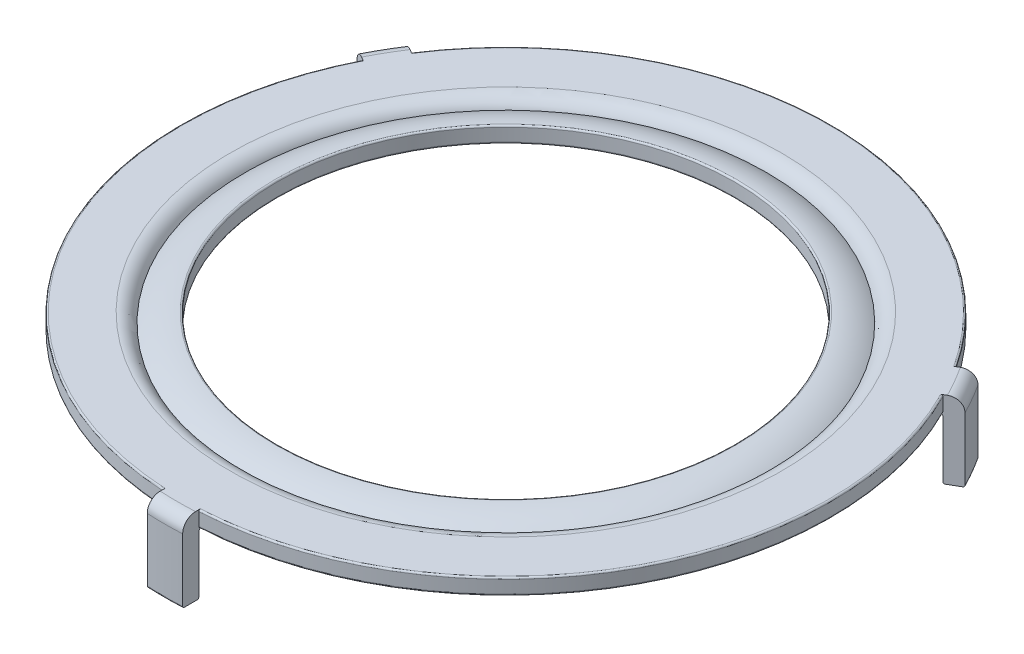
from build123d import *

# Parameters (mm, degrees)
RESSALTO_EXTRUS_O1_DEPTH = 12
FILETE1_R                = 2
FILETE2_R                = 0.25
FILETE3_R                = 0.5
FILETE4_R                = 0.25


with BuildPart() as part:
    # Esboço1 → Revolução2 (revolve)
    with BuildSketch(Plane.XY, mode=Mode.PRIVATE) as revolu_o2_sk:
        with BuildLine():
            Line((50.5, 2.1156409253243282), (50.5, 4.615640925324328))
            Line((50.5, 4.615640925324328), (42.79128784747792, 4.615640925324325))
            ThreePointArc((42.79128784747792, 4.615640925324325), (41.421981453715006, 4.207290991659514), (40.5, 3.1156409253243265))
            ThreePointArc((40.5, 3.1156409253243265), (38.109307633859444, 4.229999704855797), (35.5, 4.6156409253243265))
            Line((35.5, 4.6156409253243265), (35.5, 2.115640925324327))
            Line((35.5, 2.115640925324327), (38.5, 2.115640925324326))
            ThreePointArc((38.5, 2.115640925324326), (41.375, 0.8967153579852054), (44.25, 2.115640925324326))
            Line((44.25, 2.115640925324326), (50.5, 2.1156409253243282))
        make_face()
    revolve(revolu_o2_sk.sketch.rotate(Axis((0, -40.04789590254706, 0), (0, 1, 0)), 90), axis=Axis((0, -40.04789590254706, 0), (0, 1, 0)))

    # Esboço2 → Ressalto-extrusão1 (add)
    with BuildSketch(Plane(origin=(0, 4.6156409253243265, 0), x_dir=(1, 0, 0), z_dir=(0, 1, 0))):
        with BuildLine():
            Line((-47.21251874829168, 24.082733927903796), (-45.04439002321137, 22.83096422484113))
            ThreePointArc((-45.04439002321138, 22.830964224841132), (-43.734282891106815, 25.24999999999606), (-42.29439002321152, 27.594103945655235))
            Line((-42.29439002321151, 27.594103945655238), (-44.46251874829165, 28.845873648718204))
            ThreePointArc((-44.46251874829164, 28.8458736487182), (-45.899346400575126, 26.50000000000022), (-47.21251874829167, 24.082733927903792))
        make_face()
        with BuildLine():
            ThreePointArc((42.29439002321179, 27.594103945654822), (43.73428289110706, 25.249999999995644), (45.04439002321159, 22.830964224840706))
            Line((45.04439002321159, 22.83096422484071), (47.212518748292, 24.08273392790313))
            ThreePointArc((47.212518748292, 24.082733927903135), (45.899346400575496, 26.49999999999958), (44.46251874829204, 28.84587364871758))
            Line((44.46251874829204, 28.845873648717575), (42.29439002321178, 27.59410394565482))
        make_face()
        with BuildLine():
            Line((-2.750000000000071, -50.4250681704959), (-2.7500000000000027, -52.92860757662155))
            ThreePointArc((-2.7500000000000027, -52.92860757662155), (0, -53), (2.7500000000000036, -52.928607576621545))
            Line((2.7500000000000027, -52.92860757662155), (2.7499999999995683, -50.425068170495926))
            ThreePointArc((2.7499999999995683, -50.42506817049593), (-2.5191e-13, -50.499999999991665), (-2.7500000000000715, -50.425068170495905))
        make_face()
    extrude(amount=-RESSALTO_EXTRUS_O1_DEPTH)

    # Filete1
    filete1_edges = [part.edges().sort_by_distance(p)[0] for p in [
        (-45.899346400575126, 4.6156409253243265, -26.50000000000022),
        (45.899346400575496, 4.6156409253243265, -26.49999999999958),
        (2e-15, 4.6156409253243265, 53),
    ]]
    fillet(filete1_edges, radius=FILETE1_R)

    # Filete2
    filete2_edges = [part.edges().sort_by_distance(p)[0] for p in [
        (-45.899346400575126, -7.3843590746756735, -26.50000000000022),
        (-43.734282891106815, -7.3843590746756735, -25.249999999996064),
        (45.899346400575496, -7.3843590746756735, -26.49999999999958),
        (43.73428289110706, -7.3843590746756735, -25.249999999995637),
        (2e-15, -7.3843590746756735, 53),
        (-2.5147e-13, -7.3843590746756735, 50.49999999999167),
    ]]
    fillet(filete2_edges, radius=FILETE2_R)

    # Filete3
    # the kernel refuses this fillet: 0.5 mm, written as the material it adds along each edge
    with BuildSketch(Plane(origin=(0, 2.1156409253243282, 0), x_dir=(0.9028843153664264, 0, -0.4298836040898738), z_dir=(0.4298836040898738, 0, 0.9028843153664264))) as filete3_piece_1_section:
        with BuildLine():
            CenterArc((50.499999999991694 - FILETE3_R, -FILETE3_R), FILETE3_R, 0, 90)
            Line((50.4999999999917, -FILETE3_R), (50.499999999991694, 0))
            Line((50.499999999991694, 0), (50.499999999991694 - FILETE3_R, 0))
        make_face()
    filete3_piece_1 = revolve(axis=Axis((0, 2.1156409253243282, 0), (0, 1, 0)), revolution_arc=9.079652812762179, mode=Mode.PRIVATE)
    filete3_piece_1 = split(filete3_piece_1, bisect_by=Plane(origin=(42.24088038823217, 2.0039570628820855, -27.563210143495105), z_dir=(0.49999999999997263, 0, 0.8660254037844545)), keep=Keep.TOP, mode=Mode.PRIVATE)
    filete3_piece_1 = split(filete3_piece_1, bisect_by=Plane(origin=(44.990880388231496, 2.0039570628820855, -22.800070422680726), z_dir=(-0.49999999999984684, 0, -0.8660254037845273)), keep=Keep.TOP, mode=Mode.PRIVATE)
    add(filete3_piece_1)
    with BuildSketch(Plane(origin=(0, 2.1156409253243282, 0), x_dir=(-0.07915203587100311, 0, 0.9968625558307803), z_dir=(-0.9968625558307803, 0, -0.07915203587100311))) as filete3_piece_2_section:
        with BuildLine():
            CenterArc((50.50000000000008 - FILETE3_R, -FILETE3_R), FILETE3_R, 0, 90)
            Line((50.50000000000008, -FILETE3_R), (50.50000000000008, 0))
            Line((50.50000000000008, 0), (50.50000000000008 - FILETE3_R, 0))
        make_face()
    filete3_piece_2 = revolve(axis=Axis((0, 2.1156409253243282, 0), (0, 1, 0)), revolution_arc=9.079652812764522, mode=Mode.PRIVATE)
    filete3_piece_2 = split(filete3_piece_2, bisect_by=Plane(origin=(-2.750000000000073, 2.0039570615884563, 50.36328056605681), z_dir=(1, 0, -2.732e-14)), keep=Keep.TOP, mode=Mode.PRIVATE)
    filete3_piece_2 = split(filete3_piece_2, bisect_by=Plane(origin=(2.7499999999995577, 2.0039570615884563, 50.363280566056254), z_dir=(-1, 0, 1.7348e-13)), keep=Keep.TOP, mode=Mode.PRIVATE)
    add(filete3_piece_2)
    with BuildSketch(Plane(origin=(0, 2.1156409253243282, 0), x_dir=(-0.8237322794954426, 0, -0.5669789517409284), z_dir=(0.5669789517409284, 0, -0.8237322794954426))) as filete3_piece_3_section:
        with BuildLine():
            CenterArc((50.49999999999168 - FILETE3_R, -FILETE3_R), FILETE3_R, 0, 90)
            Line((50.49999999999168 - FILETE3_R, 0), (50.49999999999168, 0))
            Line((50.49999999999168, 0), (50.49999999999168, -FILETE3_R))
        make_face()
    filete3_piece_3 = revolve(axis=Axis((0, 2.1156409253243282, 0), (0, 1, 0)), revolution_arc=9.079652812762262, mode=Mode.PRIVATE)
    filete3_piece_3 = split(filete3_piece_3, bisect_by=Plane(origin=(-44.99088038823965, 2.0039570626357412, -22.800070422685973), z_dir=(0.49999999999993744, 0, -0.8660254037844748)), keep=Keep.TOP, mode=Mode.PRIVATE)
    filete3_piece_3 = split(filete3_piece_3, bisect_by=Plane(origin=(-42.240880388239844, 2.0039570626357412, -27.5632101435001), z_dir=(-0.5000000000000564, 0, 0.8660254037844062)), keep=Keep.TOP, mode=Mode.PRIVATE)
    add(filete3_piece_3)

    # Filete4
    filete4_edges = [part.edges().sort_by_distance(p)[0] for p in [
        (2.4869e-13, 4.615640925324328, -50.5),
        (2.3803e-13, 2.1156409253243282, -50.50000000000001),
        (43.73428289111403, 4.615640925324328, 25.250000000000217),
        (43.73428289111443, 2.1156409253243282, 25.249999999999517),
        (-43.734282891114276, 4.615640925324328, 25.249999999999773),
        (-43.73428289111466, 2.1156409253243282, 25.249999999999112),
        (-8.29e-15, 2.1156409253243282, 35.5),
        (-8.29e-15, 4.615640925324328, 35.5),
    ]]
    fillet(filete4_edges, radius=FILETE4_R)


solid = part.part
